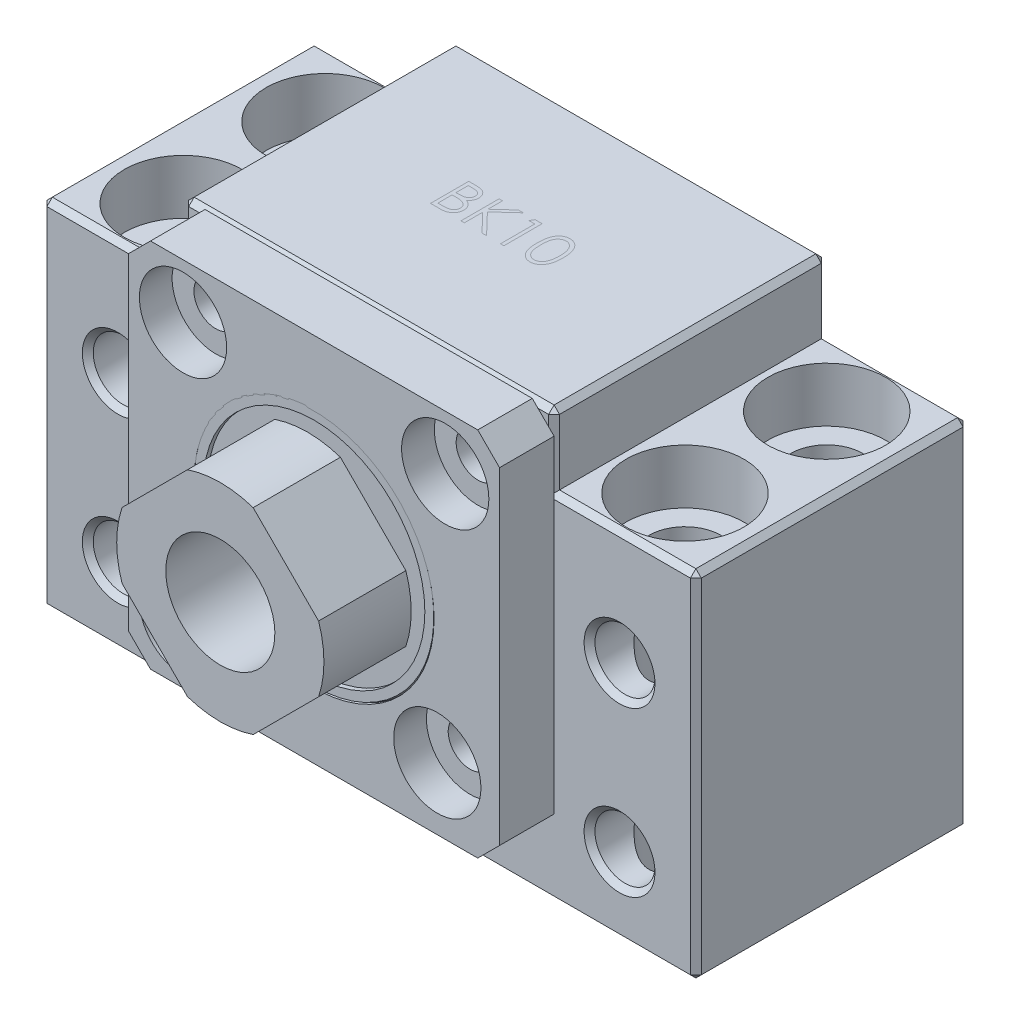
from build123d import *

# Parameters (mm, degrees)
SKETCH1_R           = 2.75
BOSS_EXTRUDE1_DEPTH = 25
HOLE1_D             = 21
HOLE1_CBORE_D       = 26
HOLE1_CBORE_DEPTH   = 20
SKETCH10_R          = 3.3
CUT_EXTRUDE3_DEPTH  = 47.703854231
SKETCH11_R          = 5.4
CUT_EXTRUDE4_DEPTH  = 5
CHAMFER3_SIZE       = 0.5
SKETCH14_R          = 2
SKETCH14_R_2        = 11
BOSS_EXTRUDE2_DEPTH = 5
SKETCH15_R          = 4
CUT_EXTRUDE5_DEPTH  = 3
SKETCH16_W          = 1.045765198
SKETCH16_H          = 1.945305348
SKETCH17_R          = 11
CUT_EXTRUDE6_DEPTH  = 8


with BuildPart() as part:
    # Sketch1 → Boss-Extrude1 (new body)
    with BuildSketch(Plane(origin=(0, 0, -10), x_dir=(-1, 0, 0), z_dir=(0, 0, -1))):
        Polygon((-30, -0.121488027), (30, -0.121488027), (30, 32.378511973), (17, 32.378511973), (17, 38.878511973), (-17, 38.878511973), (-17, 32.378511973), (-30, 32.378511973), align=None)
        with Locations((-23, 21.898511973)):
            Circle(SKETCH1_R, mode=Mode.SUBTRACT)
        with Locations((23, 21.898511973)):
            Circle(SKETCH1_R, mode=Mode.SUBTRACT)
        with Locations((23, 6.898511973)):
            Circle(SKETCH1_R, mode=Mode.SUBTRACT)
        with Locations((-23, 6.898511973)):
            Circle(SKETCH1_R, mode=Mode.SUBTRACT)
    extrude(amount=-BOSS_EXTRUDE1_DEPTH)

    # Hole1 (through all)
    with Locations(Plane(origin=(0, 0, 15), x_dir=(-1, 0, 0), z_dir=(0, 0, 1))):
        with Locations((0, -21.898511973)):
            CounterBoreHole(HOLE1_D / 2, HOLE1_CBORE_D / 2, HOLE1_CBORE_DEPTH)

    # Sketch10 → Cut-Extrude3 (cut, through all)
    with BuildSketch(Plane(origin=(0, 32.378511973, 0), x_dir=(1, 0, 0), z_dir=(0, 1, 0))):
        with Locations((-23, 4)):
            Circle(SKETCH10_R)
        with Locations((23, 4)):
            Circle(SKETCH10_R)
        with Locations((-23, -9)):
            Circle(SKETCH10_R)
        with Locations((23, -9)):
            Circle(SKETCH10_R)
    extrude(amount=-CUT_EXTRUDE3_DEPTH, mode=Mode.SUBTRACT)

    # Sketch11 → Cut-Extrude4 (cut)
    with BuildSketch(Plane(origin=(0, 32.378511973, 0), x_dir=(1, 0, 0), z_dir=(0, 1, 0))):
        with Locations((-23, 4)):
            Circle(SKETCH11_R)
        with Locations((23, 4)):
            Circle(SKETCH11_R)
        with Locations((-23, -9)):
            Circle(SKETCH11_R)
        with Locations((23, -9)):
            Circle(SKETCH11_R)
    extrude(amount=-CUT_EXTRUDE4_DEPTH, mode=Mode.SUBTRACT)

    # Chamfer3
    chamfer3_edges = [part.edges().sort_by_distance(p)[0] for p in [
        (0, -0.121488027, -10),
        (30, 16.128511973, -10),
        (23.5, 32.378511973, -10),
        (17, 35.628511973, -10),
        (0, 38.878511973, -10),
        (-17, 35.628511973, -10),
        (-23.5, 32.378511973, -10),
        (-30, 16.128511973, -10),
        (25.75, 21.898511973, -10),
        (-20.25, 21.898511973, -10),
        (-20.25, 6.898511973, -10),
        (25.75, 6.898511973, -10),
        (-23.5, 32.378511973, 15),
        (-17, 35.628511973, 15),
        (0, 38.878511973, 15),
        (17, 35.628511973, 15),
        (23.5, 32.378511973, 15),
        (30, 16.128511973, 15),
        (0, -0.121488027, 15),
        (-30, 16.128511973, 15),
        (25.75, 21.898511973, 15),
        (-20.25, 21.898511973, 15),
        (-20.25, 6.898511973, 15),
        (25.75, 6.898511973, 15),
        (-30, 32.378511973, 2.5),
        (-30, -0.121488027, 2.5),
        (30, -0.121488027, 2.5),
        (30, 32.378511973, 2.5),
        (17, 38.878511973, 2.5),
        (-17, 38.878511973, 2.5),
        (13, 21.898511973, 15),
        (-10.5, 21.898511973, -10),
    ]]
    chamfer(chamfer3_edges, length=CHAMFER3_SIZE)


with BuildPart() as body_2:
    # Sketch14 → Boss-Extrude2 (new body)
    with BuildSketch(Plane.XY.offset(15)):
        Polygon((-15, 38.898511973), (-17, 36.898511973), (-17, 6.898511973), (-15, 4.898511973), (15, 4.898511973), (17, 6.898511973), (17, 36.898511973), (15, 38.898511973), align=None)
        with Locations((-12.02081528, 9.877696692)):
            Circle(SKETCH14_R, mode=Mode.SUBTRACT)
        with Locations((11.293039945, 10.605472027)):
            Circle(SKETCH14_R, mode=Mode.SUBTRACT)
        with Locations((12.02081528, 33.919327253)):
            Circle(SKETCH14_R, mode=Mode.SUBTRACT)
        with Locations((-12.02081528, 33.919327253)):
            Circle(SKETCH14_R, mode=Mode.SUBTRACT)
        with Locations((0, 21.898511973)):
            Circle(SKETCH14_R_2, mode=Mode.SUBTRACT)
    extrude(amount=BOSS_EXTRUDE2_DEPTH)

    # Sketch15 → Cut-Extrude5 (cut)
    with BuildSketch(Plane.XY.offset(20)):
        with Locations((-12.02081528, 33.919327253)):
            Circle(SKETCH15_R)
        with Locations((12.02081528, 33.919327253)):
            Circle(SKETCH15_R)
        with Locations((-12.02081528, 9.877696692)):
            Circle(SKETCH15_R)
        with Locations((11.293039945, 10.605472027)):
            Circle(SKETCH15_R)
    extrude(amount=-CUT_EXTRUDE5_DEPTH, mode=Mode.SUBTRACT)


with BuildPart() as body_3:
    # Sketch16 → Revolve1 (revolve)
    # profile 1 of 3: a face of its own
    with BuildSketch(Plane(origin=(0, 0, 0), x_dir=(0, 0, -1), z_dir=(1, 0, 0))):
        Polygon((-20.6, 15.02), (-19.572933314, 15.02), (-19.572933314, 11.86713784), (-20, 11.86713784), (-20, 11.046430571), (-19.786466657, 10.930367031), (-16.712901969, 10.930367031), (-16.712901969, 16.623661086), (-20.6, 16.623661086), (-20.6, 17.02), (-28.6, 17.02), (-28.6, 12.52), (-20.6, 12.52), align=None)
    # profile 2 of 3: a face of its own
    with BuildSketch(Plane(origin=(0, 0, 0), x_dir=(0, 0, -1), z_dir=(1, 0, 0))):
        Polygon((10.4, 17.02), (-11, 17.02), (-11, 8.898511973), (5, 8.898511973), (5, 11.473589915), (9.505179317, 11.473589915), (9.505179317, 13.074694652), (8.345150213, 13.074694652), (8.345150213, 15.016012529), (10.4, 15.016012529), align=None)
        with Locations((5.522882599, 14.047347326)):
            Rectangle(SKETCH16_W, SKETCH16_H, mode=Mode.SUBTRACT)
    # profile 3 of 3: a face of its own
    with BuildSketch(Plane(origin=(0, 0, 0), x_dir=(0, 0, -1), z_dir=(1, 0, 0))):
        Polygon((-16.6, 17.02), (-16.6, 15.016012529), (-14.445150213, 15.016012529), (-14.445150213, 13.074694652), (-15.537963996, 13.074694652), (-15.537963996, 10.930367031), (-11.126638066, 10.930367031), (-11.126638066, 13.074609177), (-12.254682341, 13.074609177), (-12.254682341, 15.019914524), (-11.13728513, 15.019914524), (-11.13728513, 17.02), align=None)
    revolve(axis=Axis((0, 22.02, 15), (0, 0, -1)))

    # Sketch17 → Cut-Extrude6 (cut)
    with BuildSketch(Plane.XY.offset(28.6)):
        with Locations((0, 22.02)):
            Circle(SKETCH17_R)
        Polygon((-1.994582609, 32.046231852), (-10.068082772, 23.97273169), (-10.112055934, 20.111241472), (-1.994582609, 11.993768148), (1.994582609, 11.993768148), (10.068082772, 20.06726831), (10.068082772, 23.97273169), (1.994582609, 32.046231852), align=None, mode=Mode.SUBTRACT)
    extrude(amount=-CUT_EXTRUDE6_DEPTH, mode=Mode.SUBTRACT)


solid = Compound([part.part, body_2.part, body_3.part])
